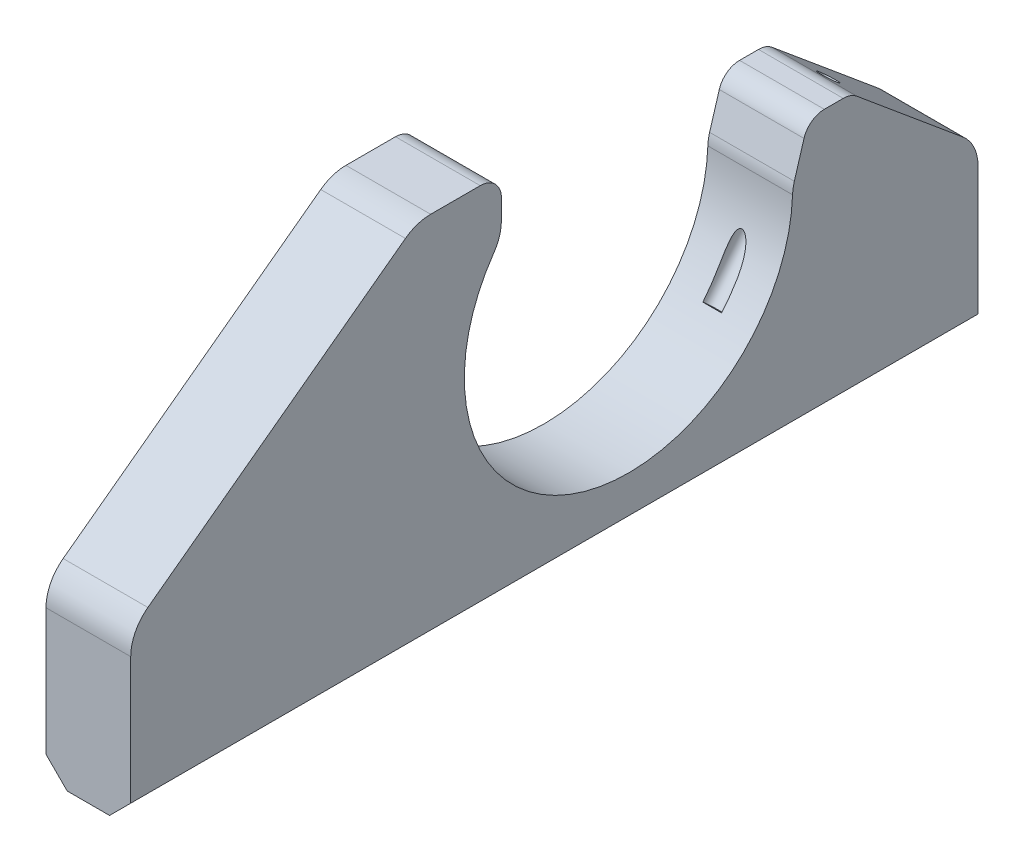
from build123d import *

# Parameters (mm, degrees)
EXTRUDE_1_DEPTH     = 20
M10X1_0_1_OUTLINE_R = 4.5
M10X1_0_1_DEPTH     = 86.424893955
FILLET_1_R          = 10
FILLET_2_R          = 20
CHAMFER_1_SIZE      = 10


# Read off the part's stored shape, not the designer's step: M10x1.0 螺纹孔1
with BuildPart() as part:
    # 草图1 → 凸台-拉伸1 (new, symmetric)
    with BuildSketch(Plane(origin=(0, 0, 0), x_dir=(0, 0, -1), z_dir=(1, 0, 0))):
        with BuildLine():
            Line((-235, -105), (165, -105))
            Line((165, -105), (165, -25))
            Line((165, -25), (105, 25))
            Line((105, 25), (85, 25))
            Line((85, 25), (77.5, 0))
            ThreePointArc((77.5, 0), (-26.04083332, -72.994006603), (-60, 49.053542176))
            Line((-60, 49.053542176), (-60, 75))
            Line((-60, 75), (-100, 75))
            Line((-100, 75), (-235, -25))
            Line((-235, -25), (-235, -105))
        make_face()
    extrude(amount=EXTRUDE_1_DEPTH, both=True)

    # M10x1.0 螺纹孔1 outline → M10x1.0 螺纹孔1 (cut)
    with BuildSketch(Plane(origin=(0, 0, 0), x_dir=(1, 0, 0), z_dir=(0, 0.7682212795973757, -0.6401843996644799))):
        with Locations((0, 76.658624366)):
            Circle(M10X1_0_1_OUTLINE_R)
    extrude(amount=M10X1_0_1_DEPTH, mode=Mode.SUBTRACT)

    # 圆角1
    fillet_1_edges = [part.edges().sort_by_distance(p)[0] for p in [
        (0, 75, 60),
        (0, 25, -85),
        (0, 25, -105),
    ]]
    fillet(fillet_1_edges, radius=FILLET_1_R)

    # 圆角2
    fillet_2_edges = [part.edges().sort_by_distance(p)[0] for p in [
        (0, -25, 235),
        (0, 75, 100),
        (0, 49.053542176, 60),
        (0, 0, -77.5),
        (0, -25, -165),
    ]]
    fillet(fillet_2_edges, radius=FILLET_2_R)

    # 倒角1
    chamfer_1_edges = [part.edges().sort_by_distance(p)[0] for p in [
        (-20, -105, 35),
        (20, -105, 35),
    ]]
    chamfer(chamfer_1_edges, length=CHAMFER_1_SIZE)


solid = part.part
